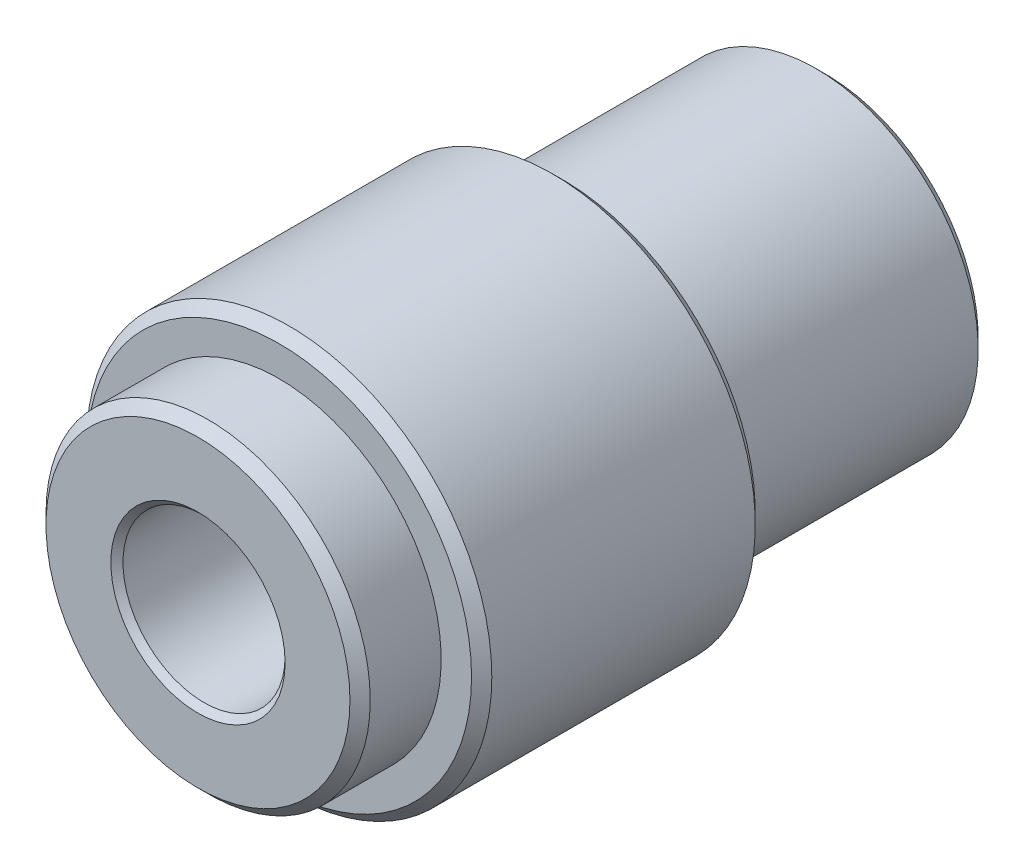
from build123d import *

# Parameters (mm, degrees)
CHAMFER_1_SIZE      = 0.25
SKETCH_2_R          = 2
CUT_EXTRUDE_1_DEPTH = 18.036725037
CHAMFER_2_SIZE      = 0.15


with BuildPart() as part:
    # ｽｹｯﾁ1 → 回転1 (revolve)
    with BuildSketch(Plane(origin=(0, 0, 0), x_dir=(0, 0, -1), z_dir=(1, 0, 0))):
        Polygon((0, 0), (0, 4), (2, 4), (2, 5), (9, 5), (9, 4), (15.5, 4), (15.5, 0), align=None)
    revolve(axis=Axis((0, 0, -15.5), (0, 0, 1)))

    # 面取り1
    chamfer_1_edges = [part.edges().sort_by_distance(p)[0] for p in [
        (0, -4, -15.5),
        (0, -4, 0),
        (0, -5, -9),
        (0, -5, -2),
    ]]
    chamfer(chamfer_1_edges, length=CHAMFER_1_SIZE)

    # ｽｹｯﾁ2 → ｶｯﾄ - 押し出し1 (cut, through all)
    with BuildSketch(Plane.XY):
        Circle(SKETCH_2_R)
    extrude(amount=-CUT_EXTRUDE_1_DEPTH, mode=Mode.SUBTRACT)

    # 面取り2
    chamfer_2_edges = [part.edges().sort_by_distance(p)[0] for p in [
        (-2, 0, 0),
        (-2, 0, -15.5),
    ]]
    chamfer(chamfer_2_edges, length=CHAMFER_2_SIZE)


solid = part.part
